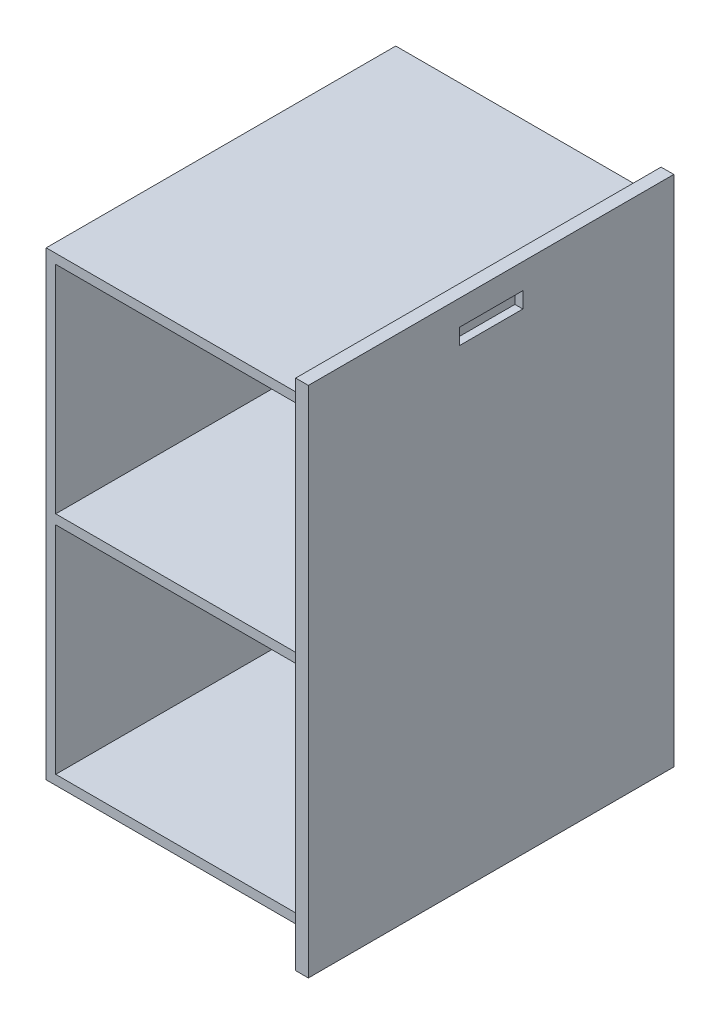
from build123d import *

# Parameters (mm, degrees)
SKETCH1_W           = 431.8
SKETCH1_H           = 736.6
SKETCH1_W_2         = 401.32
SKETCH1_H_2         = 706.12
SKETCH1_H_3         = 15.24
BOSS_EXTRUDE1_DEPTH = 558.8
SKETCH3_W           = 584.2
SKETCH3_H           = 820.42
BOSS_EXTRUDE2_DEPTH = 20.32
SKETCH4_W           = 101.6
SKETCH4_H           = 25.4
CUT_EXTRUDE1_DEPTH  = 12.7
CUT_EXTRUDE2_DEPTH  = 7.62
FILLET1_R           = 7.46
FILLET2_R           = 2.54
SKETCH6_R           = 2.54
CUT_EXTRUDE3_DEPTH  = 9.906


with BuildPart() as part:
    # Sketch1 → Boss-Extrude1 (new body)
    # profile 1 of 2: a face of its own
    with BuildSketch(Plane.XY):
        Rectangle(SKETCH1_W, SKETCH1_H)
        Rectangle(SKETCH1_W_2, SKETCH1_H_2, mode=Mode.SUBTRACT)
    # profile 2 of 2: a face of its own
    with BuildSketch(Plane.XY):
        Rectangle(SKETCH1_W_2, SKETCH1_H_3)
    extrude(amount=BOSS_EXTRUDE1_DEPTH)

    # Sketch3 → Boss-Extrude2 (add)
    with BuildSketch(Plane(origin=(215.9, 0, 0), x_dir=(0, 0, -1), z_dir=(1, 0, 0))):
        with Locations((-279.4, -10.16)):
            Rectangle(SKETCH3_W, SKETCH3_H)
    extrude(amount=-BOSS_EXTRUDE2_DEPTH)

    # Sketch4 → Cut-Extrude1 (cut)
    with BuildSketch(Plane(origin=(215.9, 0, 0), x_dir=(0, 0, -1), z_dir=(1, 0, 0))):
        with Locations((-279.4, 347.087877014)):
            Rectangle(SKETCH4_W, SKETCH4_H)
    extrude(amount=-CUT_EXTRUDE1_DEPTH, mode=Mode.SUBTRACT)

    # Sketch5 → Cut-Extrude2 (cut)
    with BuildSketch(Plane.XZ.offset(-359.787877014)):
        Polygon((211.571045912, 228.6), (211.571045912, 330.2), (207.242091825, 330.2), (203.2, 330.2), (203.2, 228.6), (207.242091825, 228.6), align=None)
    extrude(amount=-CUT_EXTRUDE2_DEPTH, mode=Mode.SUBTRACT)

    # Fillet1
    # the kernel refuses this fillet: 7.46 mm, written as the material it takes off along each edge
    with BuildSketch(Plane(origin=(211.571045912, 359.787877014, 228.6), x_dir=(0, 1, 0), z_dir=(0, 0, 1))) as fillet1_piece_1:
        with BuildLine():
            CenterArc((6.771126309, -7.46), FILLET1_R, 90, 65.183641266)
            Line((0, -4.328954088), (-0.135422526, -4.266333169))
            ThreePointArc((-0.135422526, -4.266333169), (-0.1492, -2.164477044), (-0.1492, 0))
            Line((-0.1492, 0), (0, 0.1492))
            Line((0, 0.1492), (6.771126309, 0.1492))
            Line((6.771126309, 0.1492), (6.771126309, 0))
        make_face()
    extrude(amount=101.6, mode=Mode.SUBTRACT)

    # Fillet2
    fillet2_edges = [part.edges().sort_by_distance(p)[0] for p in [
        (211.571045912, 367.407877014, 279.4),
    ]]
    fillet(fillet2_edges, radius=FILLET2_R)

    # Sketch6 → Cut-Extrude3 (cut)
    with BuildSketch(Plane.ZY.offset(215.9)):
        with Locations((441.685832518, 330.962)):
            Circle(SKETCH6_R)
        with Locations((401.553832518, 330.962)):
            Circle(SKETCH6_R)
        with Locations((421.619832518, 315.976)):
            Circle(SKETCH6_R)
        with Locations(Location((137.180167482, 315.976, 0), (0, 0, 180))):
            Circle(SKETCH6_R)
        with Locations(Location((157.246167482, 330.962, 0), (0, 0, 180))):
            Circle(SKETCH6_R)
        with Locations(Location((117.114167482, 330.962, 0), (0, 0, 180))):
            Circle(SKETCH6_R)
    extrude(amount=-CUT_EXTRUDE3_DEPTH, mode=Mode.SUBTRACT)


solid = part.part
